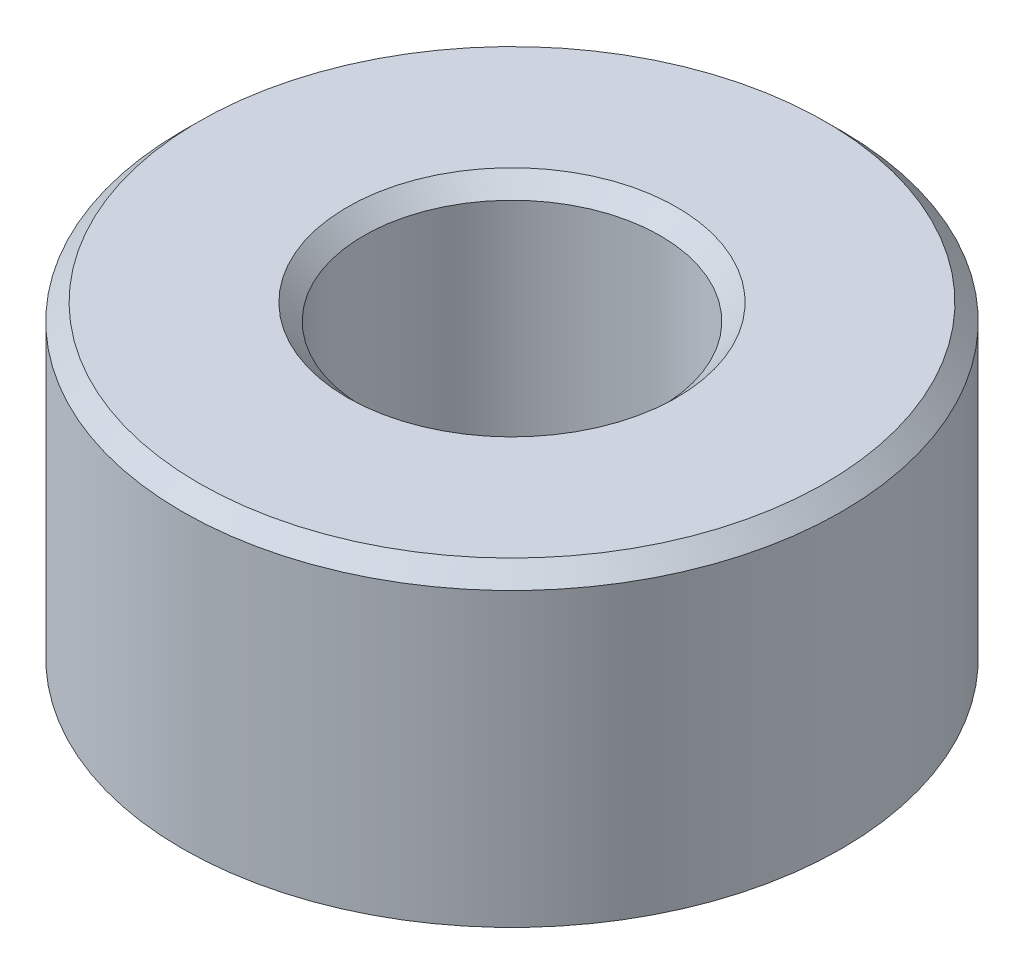
from build123d import *

# Parameters (mm, degrees)
SKETCH1_R     = 10
SKETCH1_R_2   = 4.5
BODY_DEPTH    = 9.35
CHAMFER1_SIZE = 0.5


with BuildPart() as part:
    # Sketch1 → Body (new body)
    with BuildSketch(Plane(origin=(0, 0, 0), x_dir=(1, 0, 0), z_dir=(0, 1, 0))):
        Circle(SKETCH1_R)
        Circle(SKETCH1_R_2, mode=Mode.SUBTRACT)
    extrude(amount=BODY_DEPTH)

    # Chamfer1
    chamfer1_edges = [part.edges().sort_by_distance(p)[0] for p in [
        (-10, 9.35, 0),
        (-4.5, 9.35, 0),
    ]]
    chamfer(chamfer1_edges, length=CHAMFER1_SIZE)


solid = part.part
